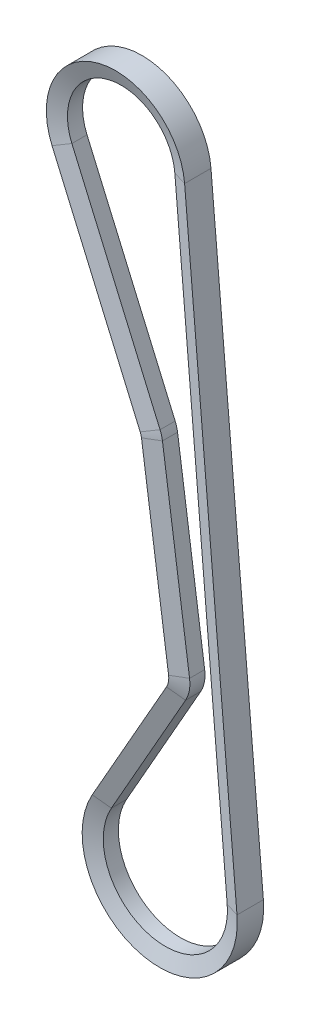
from build123d import *


with BuildPart() as part:
    # Sweep1: sweep along a path in Sketch2
    with BuildLine(Plane.XY) as sweep1_path:
        Line((24.907454374, 2.149119956), (43.817951534, -217.016098766))
        ThreePointArc((43.817951534, -217.016098766), (9.938189743, -246.776335416), (-8.422018966, -205.588804771))
        Line((-8.422018966, -205.588804771), (18.364241457, -158.454204936))
        ThreePointArc((18.364241457, -158.454204936), (19.081275614, -156.505101478), (19.131074253, -154.428888009))
        Line((19.131074253, -154.428888009), (9.343272691, -85.116559087))
        ThreePointArc((9.343272691, -85.116559087), (9.168203319, -84.284207106), (8.883463682, -83.48271946))
        Line((8.883463682, -83.48271946), (-22.944131496, -9.928082892))
        ThreePointArc((-22.944131496, -9.928082892), (-6.117872697, 24.239876932), (24.907454374, 2.149119956))
    # Sketch3 → Sweep1 (sweep)
    with BuildSketch(Plane(origin=(-22.944131496, -9.928082892, 0), x_dir=(0.9177652598252128, 0.39712331568161485, 0), z_dir=(-0.39712331568161485, 0.9177652598252128, 0))):
        Polygon((0, -4.7625), (0, 4.7625), (5.588, 2.728634331), (5.588, -2.728634331), align=None)
    sweep(path=sweep1_path.line)


solid = part.part
